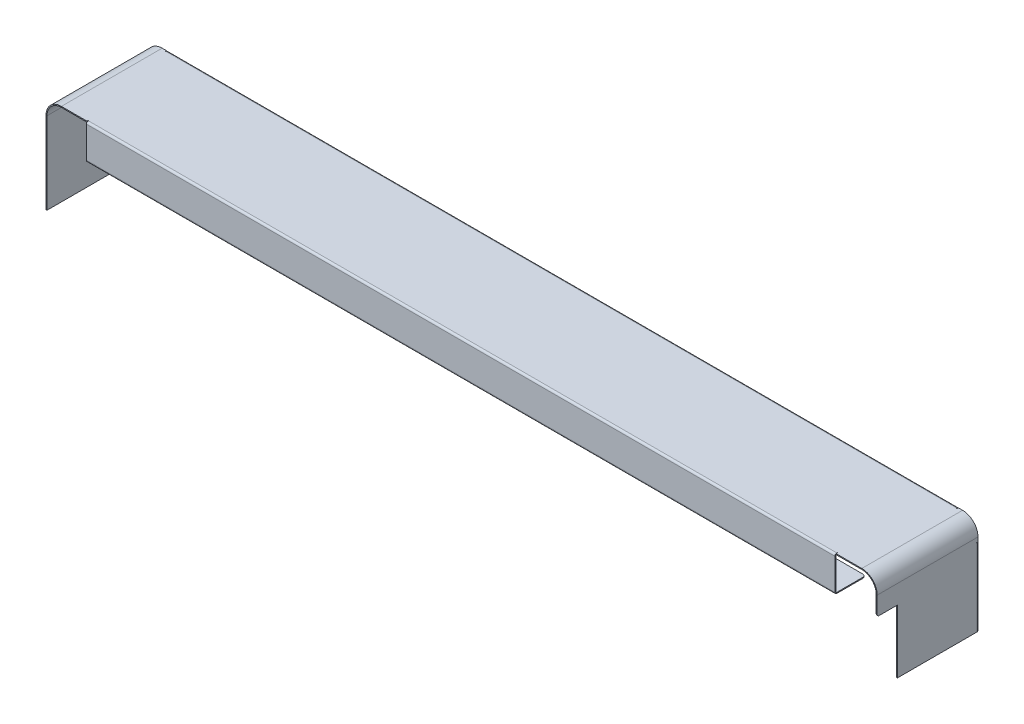
from build123d import *

# Parameters (mm, degrees)
BASE_FLANGE1_DEPTH             = 104.7
EDGE_FLANGE1_STRIP_W           = 6
EDGE_FLANGE1_STRIP_H           = 1
EDGE_FLANGE1_STRIP_CUT_DEPTH   = 821.4
EDGE_FLANGE1_RELIEF_W          = 6.5
EDGE_FLANGE1_RELIEF_H          = 0.5
EDGE_FLANGE1_RELIEF_CUT_DEPTH  = 1
EDGE_FLANGE1_DEPTH             = 821.4
EDGE_FLANGE2_STRIP_W           = 6
EDGE_FLANGE2_STRIP_H           = 1
EDGE_FLANGE2_STRIP_CUT_DEPTH   = 821.4
EDGE_FLANGE2_DEPTH             = 821.4
EDGE_FLANGE3_STRIP_W           = 6
EDGE_FLANGE3_STRIP_H           = 1
EDGE_FLANGE3_STRIP_CUT_DEPTH   = 80
EDGE_FLANGE3_RELIEF_W          = 6.5
EDGE_FLANGE3_RELIEF_H          = 0.5
EDGE_FLANGE3_RELIEF_CUT_DEPTH  = 1
EDGE_FLANGE3_DEPTH             = 80
EDGE_FLANGE4_STRIP_W           = 6
EDGE_FLANGE4_STRIP_H           = 1
EDGE_FLANGE4_STRIP_CUT_DEPTH   = 80
EDGE_FLANGE4_DEPTH             = 80
EDGE_FLANGE5_STRIP_W           = 6
EDGE_FLANGE5_STRIP_H           = 1
EDGE_FLANGE5_STRIP_CUT_DEPTH   = 777.4
EDGE_FLANGE5_RELIEF_W          = 6.5
EDGE_FLANGE5_RELIEF_H          = 0.5
EDGE_FLANGE5_RELIEF_CUT_DEPTH  = 1
EDGE_FLANGE5_DEPTH             = 777.4
SKETCH25_R                     = 2.5
CUT_EXTRUDE1_DEPTH             = 3
SKETCH26_R                     = 2.5
CUT_EXTRUDE2_DEPTH             = 3
CUT_EXTRUDE2_DIRECTION_2_REACH = 857.86
EDGE_FLANGE7_STRIP_W           = 6
EDGE_FLANGE7_STRIP_H           = 1
EDGE_FLANGE7_STRIP_CUT_DEPTH   = 777.4
EDGE_FLANGE7_DEPTH             = 777.4
EDGE_FLANGE7_FLAT_DEPTH        = 1
SKETCH30_W                     = 21
SKETCH30_H                     = 65.6
CUT_EXTRUDE3_DEPTH             = 10
FILLET1_R                      = 2


# Sheet-metal steps are written as plain solids
with BuildPart() as part:
    # Sketch1 → Base-Flange1 (new body)
    with BuildSketch(Plane.XY):
        with BuildLine():
            Line((-430.7, -100), (-430.7, -15))
            ThreePointArc((-430.7, -15), (-426.306601718, -4.393398282), (-415.7, 0))
            Line((-415.7, 0), (415.7, 0))
            ThreePointArc((415.7, 0), (426.306601718, -4.393398282), (430.7, -15))
            Line((430.7, -15), (430.7, -100))
            Line((430.7, -100), (431.7, -100))
            Line((431.7, -100), (431.7, -15))
            ThreePointArc((431.7, -15), (427.013708499, -3.686291501), (415.7, 1))
            Line((415.7, 1), (-415.7, 1))
            ThreePointArc((-415.7, 1), (-427.013708499, -3.686291501), (-431.7, -15))
            Line((-431.7, -15), (-431.7, -100))
            Line((-431.7, -100), (-430.7, -100))
        make_face()
    extrude(amount=BASE_FLANGE1_DEPTH)

    # Edge-Flange1 strip (across the edge) → Edge-Flange1 strip cut (cut)
    with BuildSketch(Plane(origin=(-410.7, 0, 0), x_dir=(0, 0, 1), z_dir=(1, 0, 0))):
        with Locations((-2, -0.5)):
            Rectangle(EDGE_FLANGE1_STRIP_W, EDGE_FLANGE1_STRIP_H)
    extrude(amount=EDGE_FLANGE1_STRIP_CUT_DEPTH, mode=Mode.SUBTRACT)

    # Edge-Flange1 relief (on the sheet) → Edge-Flange1 relief cut (cut)
    with BuildSketch(Plane(origin=(-410.7, 0, 1), x_dir=(0, 0, 1), z_dir=(0, -1, 0))):
        with Locations((-2.75, 0.25)):
            Rectangle(EDGE_FLANGE1_RELIEF_W, EDGE_FLANGE1_RELIEF_H)
        with Locations((-2.75, -821.65)):
            Rectangle(EDGE_FLANGE1_RELIEF_W, EDGE_FLANGE1_RELIEF_H)
    extrude(amount=-EDGE_FLANGE1_RELIEF_CUT_DEPTH, mode=Mode.SUBTRACT)

    # Edge-Flange1 section (across the edge) → Edge-Flange1 (add)
    with BuildSketch(Plane(origin=(-410.7, 0, 0), x_dir=(0, 0, 1), z_dir=(1, 0, 0))):
        with BuildLine():
            Line((-1, 1), (-1, 19))
            Line((-1, 19), (0, 19))
            Line((0, 19), (0, 1))
            ThreePointArc((0, 1), (0.292893219, 0.292893219), (1, 0))
            Line((1, 0), (1, -1))
            ThreePointArc((1, -1), (-0.414213562, -0.414213562), (-1, 1))
        make_face()
    extrude(amount=EDGE_FLANGE1_DEPTH)

    # Edge-Flange2 strip (across the edge) → Edge-Flange2 strip cut (cut)
    with BuildSketch(Plane(origin=(-410.7, -19, 0), x_dir=(0, 1, 0), z_dir=(1, 0, 0))):
        with Locations((-1, -0.5)):
            Rectangle(EDGE_FLANGE2_STRIP_W, EDGE_FLANGE2_STRIP_H)
    extrude(amount=EDGE_FLANGE2_STRIP_CUT_DEPTH, mode=Mode.SUBTRACT)

    # Edge-Flange2 section (across the edge) → Edge-Flange2 (add)
    with BuildSketch(Plane(origin=(-410.7, -19, 0), x_dir=(0, 1, 0), z_dir=(1, 0, 0))):
        with BuildLine():
            Line((0, 1), (0, 12))
            Line((0, 12), (1, 12))
            Line((1, 12), (1, 1))
            ThreePointArc((1, 1), (1.292893219, 0.292893219), (2, 0))
            Line((2, 0), (2, -1))
            ThreePointArc((2, -1), (0.585786438, -0.414213562), (0, 1))
        make_face()
    extrude(amount=EDGE_FLANGE2_DEPTH)

    # Edge-Flange3 strip (across the edge) → Edge-Flange3 strip cut (cut)
    with BuildSketch(Plane(origin=(-430.7, -100, 0), x_dir=(0, 0, 1), z_dir=(0, 1, 0))):
        with Locations((-2, -0.5)):
            Rectangle(EDGE_FLANGE3_STRIP_W, EDGE_FLANGE3_STRIP_H)
    edge_flange3_strip_cut = extrude(amount=EDGE_FLANGE3_STRIP_CUT_DEPTH, mode=Mode.SUBTRACT)

    # Edge-Flange3 relief (on the sheet) → Edge-Flange3 relief cut (cut)
    with BuildSketch(Plane(origin=(-430.7, -100, 1), x_dir=(0, 0, 1), z_dir=(1, 0, 0))):
        with Locations((-2.75, -80.25)):
            Rectangle(EDGE_FLANGE3_RELIEF_W, EDGE_FLANGE3_RELIEF_H)
    edge_flange3_relief_cut = extrude(amount=-EDGE_FLANGE3_RELIEF_CUT_DEPTH, mode=Mode.SUBTRACT)

    # Edge-Flange3 section (across the edge) → Edge-Flange3 (add)
    with BuildSketch(Plane(origin=(-430.7, -100, 0), x_dir=(0, 0, 1), z_dir=(0, 1, 0))):
        with BuildLine():
            Line((-1, 1), (-1, 19))
            Line((-1, 19), (0, 19))
            Line((0, 19), (0, 1))
            ThreePointArc((0, 1), (0.292893219, 0.292893219), (1, 0))
            Line((1, 0), (1, -1))
            ThreePointArc((1, -1), (-0.414213562, -0.414213562), (-1, 1))
        make_face()
    edge_flange3 = extrude(amount=EDGE_FLANGE3_DEPTH)

    # Edge-Flange4 strip (across the edge) → Edge-Flange4 strip cut (cut)
    with BuildSketch(Plane(origin=(-411.7, -100, 0), x_dir=(-1, 0, 0), z_dir=(0, 1, 0))):
        with Locations((-1, -0.5)):
            Rectangle(EDGE_FLANGE4_STRIP_W, EDGE_FLANGE4_STRIP_H)
    edge_flange4_strip_cut = extrude(amount=EDGE_FLANGE4_STRIP_CUT_DEPTH, mode=Mode.SUBTRACT)

    # Edge-Flange4 section (across the edge) → Edge-Flange4 (add)
    with BuildSketch(Plane(origin=(-411.7, -100, 0), x_dir=(-1, 0, 0), z_dir=(0, 1, 0))):
        with BuildLine():
            Line((0, 1), (0, 12))
            Line((0, 12), (1, 12))
            Line((1, 12), (1, 1))
            ThreePointArc((1, 1), (1.292893219, 0.292893219), (2, 0))
            Line((2, 0), (2, -1))
            ThreePointArc((2, -1), (0.585786438, -0.414213562), (0, 1))
        make_face()
    edge_flange4 = extrude(amount=EDGE_FLANGE4_DEPTH)

    # Mirror1: Edge-Flange3 strip cut, Edge-Flange3 relief cut, Edge-Flange3, Edge-Flange4 strip cut, Edge-Flange4 across plane
    add(edge_flange3_strip_cut.mirror(Plane(origin=(0, 0, 0), x_dir=(0, 0, 1), z_dir=(1, 0, 0))), mode=Mode.SUBTRACT)
    add(edge_flange3_relief_cut.mirror(Plane(origin=(0, 0, 0), x_dir=(0, 0, 1), z_dir=(1, 0, 0))), mode=Mode.SUBTRACT)
    add(edge_flange3.mirror(Plane(origin=(0, 0, 0), x_dir=(0, 0, 1), z_dir=(1, 0, 0))))
    add(edge_flange4_strip_cut.mirror(Plane(origin=(0, 0, 0), x_dir=(0, 0, 1), z_dir=(1, 0, 0))), mode=Mode.SUBTRACT)
    add(edge_flange4.mirror(Plane(origin=(0, 0, 0), x_dir=(0, 0, 1), z_dir=(1, 0, 0))))

    # Edge-Flange5 strip (across the edge) → Edge-Flange5 strip cut (cut)
    with BuildSketch(Plane(origin=(388.7, 0, 104.7), x_dir=(0, 0, -1), z_dir=(-1, 0, 0))):
        with Locations((-2, -0.5)):
            Rectangle(EDGE_FLANGE5_STRIP_W, EDGE_FLANGE5_STRIP_H)
    extrude(amount=EDGE_FLANGE5_STRIP_CUT_DEPTH, mode=Mode.SUBTRACT)

    # Edge-Flange5 relief (on the sheet) → Edge-Flange5 relief cut (cut)
    with BuildSketch(Plane(origin=(388.7, 0, 103.7), x_dir=(0, 0, -1), z_dir=(0, -1, 0))):
        with Locations((-2.75, 0.25)):
            Rectangle(EDGE_FLANGE5_RELIEF_W, EDGE_FLANGE5_RELIEF_H)
        with Locations((-2.75, -777.65)):
            Rectangle(EDGE_FLANGE5_RELIEF_W, EDGE_FLANGE5_RELIEF_H)
    extrude(amount=-EDGE_FLANGE5_RELIEF_CUT_DEPTH, mode=Mode.SUBTRACT)

    # Edge-Flange5 section (across the edge) → Edge-Flange5 (add)
    with BuildSketch(Plane(origin=(388.7, 0, 104.7), x_dir=(0, 0, -1), z_dir=(-1, 0, 0))):
        with BuildLine():
            Line((-1, 1), (-1, 35.5))
            Line((-1, 35.5), (0, 35.5))
            Line((0, 35.5), (0, 1))
            ThreePointArc((0, 1), (0.292893219, 0.292893219), (1, 0))
            Line((1, 0), (1, -1))
            ThreePointArc((1, -1), (-0.414213562, -0.414213562), (-1, 1))
        make_face()
    extrude(amount=EDGE_FLANGE5_DEPTH)

    # Sketch25 → Cut-Extrude1 (cut)
    with BuildSketch(Plane.XZ.offset(19)):
        with Locations(Location((-349.7, 6, 0), (0, 0, 270))):
            Circle(SKETCH25_R)
        with Locations(Location((-169.7, 6, 0), (0, 0, 270))):
            Circle(SKETCH25_R)
        with Locations(Location((10.3, 6, 0), (0, 0, 270))):
            Circle(SKETCH25_R)
        with Locations(Location((190.3, 6, 0), (0, 0, 270))):
            Circle(SKETCH25_R)
        with Locations(Location((370.3, 6, 0), (0, 0, 270))):
            Circle(SKETCH25_R)
        with Locations((550.3, 6)):
            Circle(SKETCH25_R)
        with Locations((730.3, 6)):
            Circle(SKETCH25_R)
    extrude(amount=-CUT_EXTRUDE1_DEPTH, mode=Mode.SUBTRACT)

    # Sketch26 → Cut-Extrude2 (cut)
    with BuildSketch(Plane(origin=(-411.7, 0, 0), x_dir=(0, 0, -1), z_dir=(1, 0, 0))):
        with Locations((-6, -68)):
            Circle(SKETCH26_R)
    extrude(amount=-CUT_EXTRUDE2_DEPTH, mode=Mode.SUBTRACT)

    # Cut-Extrude2 direction 2: up to this face of the body (flat: up to its plane)
    cut_extrude2_direction_2_end = Plane(part.part.faces().sort_by_distance((412.7, -60, 6.5))[0])
    # Sketch26 → Cut-Extrude2 direction 2 (cut, up to the picked face)
    with BuildSketch(Plane(origin=(-411.7, 0, 0), x_dir=(0, 0, -1), z_dir=(1, 0, 0)), mode=Mode.PRIVATE) as cut_extrude2_direction_2_sk1:
        with Locations((-6, -68)):
            Circle(SKETCH26_R)
    cut_extrude2_direction_2_tool1 = split(extrude(cut_extrude2_direction_2_sk1.sketch, amount=CUT_EXTRUDE2_DIRECTION_2_REACH, mode=Mode.PRIVATE), bisect_by=cut_extrude2_direction_2_end, keep=Keep.BOTH, mode=Mode.PRIVATE)
    add(cut_extrude2_direction_2_tool1.solids().sort_by(Axis((-411.7, -68, 6), (1, 0, 0)))[0], mode=Mode.SUBTRACT)

    # Edge-Flange7 strip (across the edge) → Edge-Flange7 strip cut (cut)
    with BuildSketch(Plane(origin=(388.7, -35.5, 104.7), x_dir=(0, 1, 0), z_dir=(-1, 0, 0))):
        with Locations((-1, -0.5)):
            Rectangle(EDGE_FLANGE7_STRIP_W, EDGE_FLANGE7_STRIP_H)
    extrude(amount=EDGE_FLANGE7_STRIP_CUT_DEPTH, mode=Mode.SUBTRACT)

    # Edge-Flange7 bend section (across the edge) → Edge-Flange7 (add)
    with BuildSketch(Plane(origin=(388.7, -35.5, 104.7), x_dir=(0, 1, 0), z_dir=(-1, 0, 0))):
        with BuildLine():
            Line((0, 1), (1, 1))
            ThreePointArc((1, 1), (1.292893219, 0.292893219), (2, 0))
            Line((2, 0), (2, -1))
            ThreePointArc((2, -1), (0.585786438, -0.414213562), (0, 1))
        make_face()
    extrude(amount=EDGE_FLANGE7_DEPTH)

    # Edge-Flange7 profile (on flange) → Edge-Flange7 flat (add)
    with BuildSketch(Plane(origin=(0, -35.5, 104.7), x_dir=(1, 0, 0), z_dir=(0, 1, 0))):
        with BuildLine():
            Line((-388.7, 1), (388.7, 1))
            Line((388.7, 1), (388.7, 28))
            ThreePointArc((388.7, 28), (387.821320344, 30.121320344), (385.7, 31))
            Line((385.7, 31), (-385.7, 31))
            ThreePointArc((-385.7, 31), (-387.821320344, 30.121320344), (-388.7, 28))
            Line((-388.7, 28), (-388.7, 1))
        make_face()
    extrude(amount=EDGE_FLANGE7_FLAT_DEPTH)

    # Sketch30 → Cut-Extrude3 (cut)
    with BuildSketch(Plane(origin=(431.7, 0, 0), x_dir=(0, 0, -1), z_dir=(1, 0, 0))):
        with Locations((-94.2, -67.2)):
            Rectangle(SKETCH30_W, SKETCH30_H)
    extrude(amount=-CUT_EXTRUDE3_DEPTH, mode=Mode.SUBTRACT)

    # Fillet1
    fillet1_edges = [part.edges().sort_by_distance(p)[0] for p in [
        (431.2, -34.4, 104.7),
    ]]
    fillet(fillet1_edges, radius=FILLET1_R)


solid = part.part
